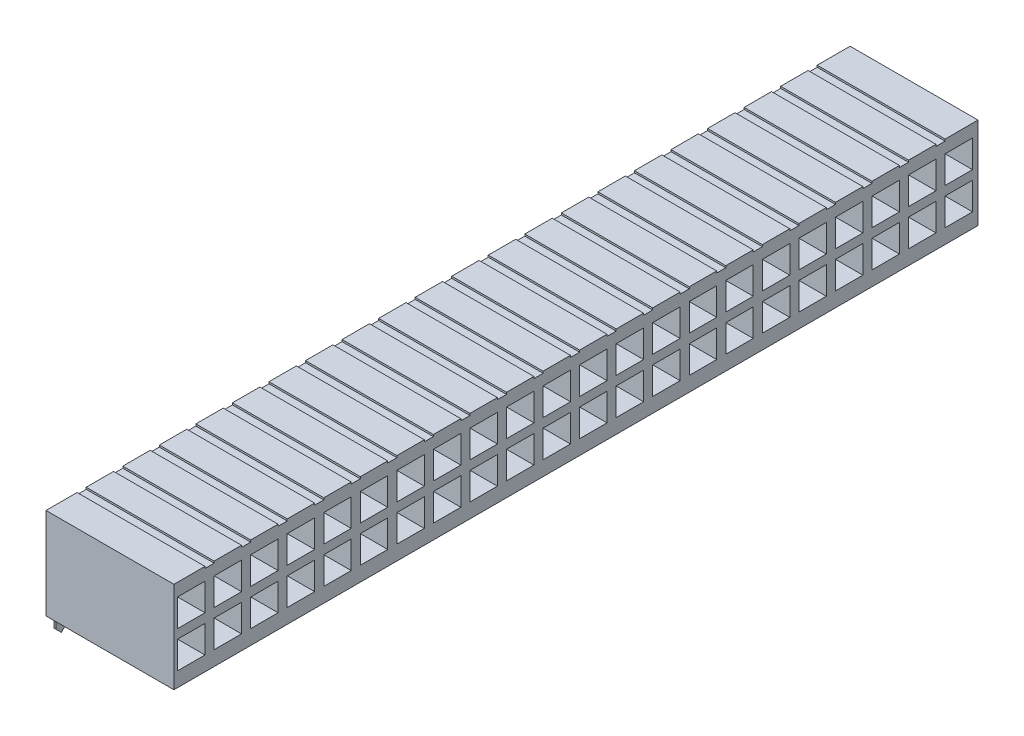
from build123d import *

# Parameters (mm, degrees)
CROQUIS1_W              = 44
CROQUIS1_H              = 5
EXTRUIR1_DEPTH          = 3.5
CROQUIS2_W              = 1.5
CROQUIS2_H              = 1.5
EXTRUIR2_DEPTH          = 24.221757039
MATRIZL1_COUNT          = 22
MATRIZL1_PITCH          = 2
MATRIZL1_COUNT_DIR2     = 2
MATRIZL1_PITCH_DIR2     = 2
CROQUIS3_W              = 3.778534295
CROQUIS3_H              = 1.5
EXTRUIR3_DEPTH          = 0.1
EXTRUIR9_DEPTH          = 0.1
CROQUIS8_W              = 1.5
CROQUIS8_H              = 0.1
EXTRUIR11_DEPTH         = 3.778534295
REDONDEO1_R             = 0.1
MATRIZL3_COUNT          = 22
MATRIZL3_PITCH          = 2
REDONDEO1_OF_MATRIZL3_R = 0.1
CROQUIS6_W              = 0.5
CROQUIS6_H              = 0.1
EXTRUIR10_DEPTH         = 24.45840173
MATRIZL4_COUNT          = 21
MATRIZL4_PITCH          = 2


with BuildPart() as part:
    # Croquis1 → Extruir1 (new, symmetric)
    with BuildSketch(Plane(origin=(0, 0, 0), x_dir=(0, 0, -1), z_dir=(1, 0, 0))):
        Rectangle(CROQUIS1_W, CROQUIS1_H)
    extrude(amount=EXTRUIR1_DEPTH, both=True)

    # Croquis2 → Extruir2 (cut, through all)
    with BuildSketch(Plane(origin=(3.5, 0, 0), x_dir=(0, 0, -1), z_dir=(1, 0, 0))):
        with Locations((-21.05, 1.05)):
            Rectangle(CROQUIS2_W, CROQUIS2_H)
    extruir2 = extrude(amount=-EXTRUIR2_DEPTH, mode=Mode.SUBTRACT)

    # MatrizL1: Extruir2 22 × 2
    with Locations(*[(0, -j * MATRIZL1_PITCH_DIR2, -i * MATRIZL1_PITCH) for i in range(MATRIZL1_COUNT) for j in range(MATRIZL1_COUNT_DIR2) if (i, j) != (0, 0)]):
        add(extruir2, mode=Mode.SUBTRACT)

    # Croquis3 → Extruir3 (add)
    with BuildSketch(Plane(origin=(0, 0.3, 0), x_dir=(1, 0, 0), z_dir=(0, 1, 0))):
        with Locations((-1.710732853, -21.05)):
            Rectangle(CROQUIS3_W, CROQUIS3_H)
    extruir3 = extrude(amount=EXTRUIR3_DEPTH)

    # Croquis5 → Extruir9 (add)
    with BuildSketch(Plane.ZY.offset(3.6)):
        Polygon((20.3, 0.4), (20.3, -1.7), (20.760017475, -2.5), (20.760017475, -3.503122872), (21.059079729, -3.802185127), (21.358141984, -3.503122872), (21.358141984, -2.5), (21.8, -1.7), (21.8, 0.4), align=None)
    extruir9 = extrude(amount=EXTRUIR9_DEPTH)

    # Croquis8 → Extruir11 (add)
    with BuildSketch(Plane(origin=(-3.6, 0, 0), x_dir=(0, 0, -1), z_dir=(1, 0, 0))):
        with Locations((-21.05, -1.65)):
            Rectangle(CROQUIS8_W, CROQUIS8_H)
    extruir11 = extrude(amount=EXTRUIR11_DEPTH)

    # Redondeo1
    redondeo1_edges = [part.edges().sort_by_distance(p)[0] for p in [
        (-3.7, 0.4, 21.05),
    ]]
    fillet(redondeo1_edges, radius=REDONDEO1_R)

    # MatrizL3: Extruir3, Extruir9, Extruir11 ×22
    with Locations(*[(0, 0, -i * MATRIZL3_PITCH) for i in range(1, MATRIZL3_COUNT)]):
        add(extruir3)
        add(extruir9)
        add(extruir11)

    # Redondeo1 of MatrizL3
    redondeo1_of_matrizl3_edges = [part.edges().sort_by_distance(p)[0] for p in [
        (-3.7, 0.4, 19.05),
        (-3.7, 0.4, 17.05),
        (-3.7, 0.4, 15.05),
        (-3.7, 0.4, 13.05),
        (-3.7, 0.4, 11.05),
        (-3.7, 0.4, 9.05),
        (-3.7, 0.4, 7.05),
        (-3.7, 0.4, 5.05),
        (-3.7, 0.4, 3.05),
        (-3.7, 0.4, 1.05),
        (-3.7, 0.4, -0.95),
        (-3.7, 0.4, -2.95),
        (-3.7, 0.4, -4.95),
        (-3.7, 0.4, -6.95),
        (-3.7, 0.4, -8.95),
        (-3.7, 0.4, -10.95),
        (-3.7, 0.4, -12.95),
        (-3.7, 0.4, -14.95),
        (-3.7, 0.4, -16.95),
        (-3.7, 0.4, -18.95),
        (-3.7, 0.4, -20.95),
    ]]
    fillet(redondeo1_of_matrizl3_edges, radius=REDONDEO1_OF_MATRIZL3_R)

    # Croquis6 → Extruir10 (cut, through all)
    with BuildSketch(Plane(origin=(3.5, 0, 0), x_dir=(0, 0, -1), z_dir=(1, 0, 0))):
        with Locations((-20.05, 2.45)):
            Rectangle(CROQUIS6_W, CROQUIS6_H)
    extruir10 = extrude(amount=-EXTRUIR10_DEPTH, mode=Mode.SUBTRACT)

    # MatrizL4: Extruir10 ×21
    with Locations(*[(0, 0, -i * MATRIZL4_PITCH) for i in range(1, MATRIZL4_COUNT)]):
        add(extruir10, mode=Mode.SUBTRACT)


solid = part.part
